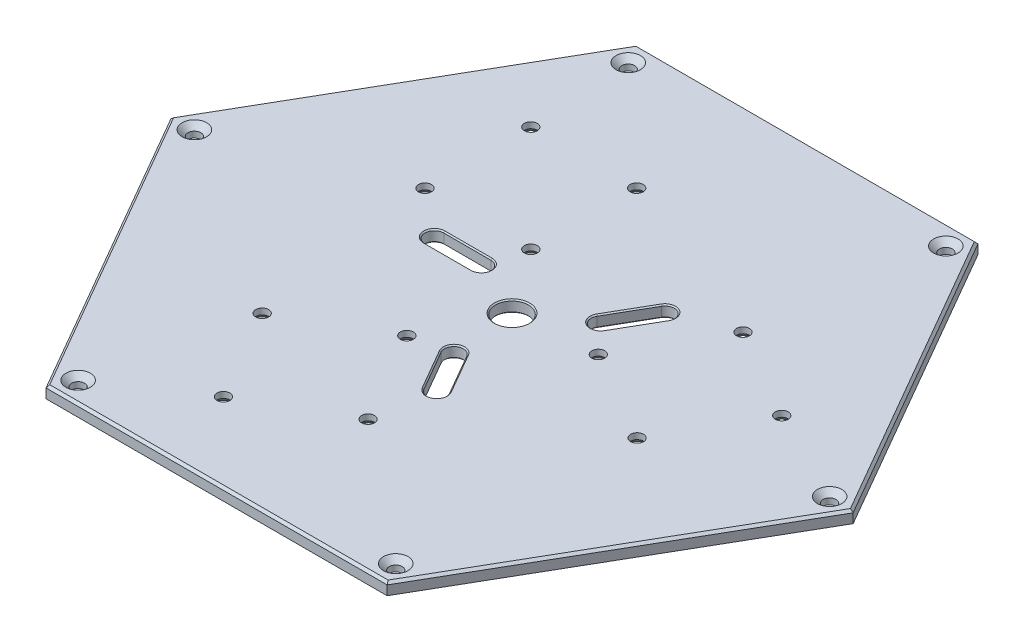
from build123d import *

# Parameters (mm, degrees)
BOSS_EXTRUDE1_DEPTH                             = 5
SKETCH5_R                                       = 7
CUT_EXTRUDE1_DEPTH                              = 192.882125275
CSK_FOR_M5_FLAT_HEAD_MACHINE_SCREW1_AT_2_COUNT  = 2
CSK_FOR_M5_FLAT_HEAD_MACHINE_SCREW1_AT_2_PITCH  = 45
CSK_FOR_M5_FLAT_HEAD_MACHINE_SCREW1_AT_3_COUNT  = 2
CSK_FOR_M5_FLAT_HEAD_MACHINE_SCREW1_AT_3_PITCH  = 63.639610307
CSK_FOR_M5_FLAT_HEAD_MACHINE_SCREW1_AT_4_COUNT  = 2
CSK_FOR_M5_FLAT_HEAD_MACHINE_SCREW1_AT_4_PITCH  = 45
CSK_FOR_M5_FLAT_HEAD_MACHINE_SCREW1_AT_5_COUNT  = 2
CSK_FOR_M5_FLAT_HEAD_MACHINE_SCREW1_AT_5_PITCH  = 101.046587643
CSK_FOR_M5_FLAT_HEAD_MACHINE_SCREW1_AT_6_COUNT  = 2
CSK_FOR_M5_FLAT_HEAD_MACHINE_SCREW1_AT_6_PITCH  = 144.828140716
CSK_FOR_M5_FLAT_HEAD_MACHINE_SCREW1_AT_7_COUNT  = 2
CSK_FOR_M5_FLAT_HEAD_MACHINE_SCREW1_AT_7_PITCH  = 159.73189246
CSK_FOR_M5_FLAT_HEAD_MACHINE_SCREW1_AT_8_COUNT  = 2
CSK_FOR_M5_FLAT_HEAD_MACHINE_SCREW1_AT_8_PITCH  = 121.44751953
CSK_FOR_M5_FLAT_HEAD_MACHINE_SCREW1_AT_9_COUNT  = 2
CSK_FOR_M5_FLAT_HEAD_MACHINE_SCREW1_AT_9_PITCH  = 76.964843439
CSK_FOR_M5_FLAT_HEAD_MACHINE_SCREW1_AT_1_COUNT  = 2
CSK_FOR_M5_FLAT_HEAD_MACHINE_SCREW1_AT_1_PITCH  = 121.44751953
CSK_FOR_M5_FLAT_HEAD_MACHINE_SCREW1_2_COUNT     = 2
CSK_FOR_M5_FLAT_HEAD_MACHINE_SCREW1_2_PITCH     = 124.337132551
CSK_FOR_M5_FLAT_HEAD_MACHINE_SCREW1_3_COUNT     = 2
CSK_FOR_M5_FLAT_HEAD_MACHINE_SCREW1_3_PITCH     = 81.448202292
CUT_EXTRUDE3_DEPTH                              = 192.882125275
CSK_FOR_M5_FLAT_HEAD_MACHINE_SCREW2_D           = 5.5
CSK_FOR_M5_FLAT_HEAD_MACHINE_SCREW2_DEPTH       = 10
CSK_FOR_M5_FLAT_HEAD_MACHINE_SCREW2_CSINK_D     = 10.4
CSK_FOR_M5_FLAT_HEAD_MACHINE_SCREW2_CSINK_ANGLE = 90
CSK_FOR_M5_FLAT_HEAD_MACHINE_SCREW2_TIP         = 1.652366702
CHAMFER1_SIZE                                   = 0.5
CHAMFER3_SIZE                                   = 0.5
CHAMFER4_SIZE                                   = 1


with BuildPart() as part:
    # Sketch1 → Boss-Extrude1 (new body)
    with BuildSketch(Plane(origin=(0, 0, 0), x_dir=(1, 0, 0), z_dir=(0, 1, 0))):
        Polygon((72.5, 125.573683549), (-72.5, 125.573683549), (-145, 0), (-72.5, -125.573683549), (72.5, -125.573683549), (145, 0), align=None)
    extrude(amount=BOSS_EXTRUDE1_DEPTH)

    # Sketch5 → Cut-Extrude1 (cut, through all)
    with BuildSketch(Plane(origin=(0, 5, 0), x_dir=(1, 0, 0), z_dir=(0, 1, 0))):
        Circle(SKETCH5_R)
    extrude(amount=-CUT_EXTRUDE1_DEPTH, mode=Mode.SUBTRACT)

    # Sketch6 → CSK for M5 Flat Head Machine Screw1 (revolve, cut)
    with BuildSketch(Plane(origin=(-64.5, 0, -27.5), x_dir=(0, 0, -1), z_dir=(1, 0, 0))):
        Polygon((0, 0), (0, 5), (2.75, 5), (2.75, 2.45), (5.2, 0), align=None)
    csk_for_m5_flat_head_machine_screw1 = revolve(axis=Axis((-64.5, -6.35, -27.5), (0, 1, 0)), mode=Mode.SUBTRACT)

    # CSK for M5 Flat Head Machine Screw1 at 2: CSK for M5 Flat Head Machine Screw1 ×2
    with Locations(*[(i * CSK_FOR_M5_FLAT_HEAD_MACHINE_SCREW1_AT_2_PITCH, 0, 0) for i in range(1, CSK_FOR_M5_FLAT_HEAD_MACHINE_SCREW1_AT_2_COUNT)]):
        add(csk_for_m5_flat_head_machine_screw1, mode=Mode.SUBTRACT)

    # CSK for M5 Flat Head Machine Screw1 at 3: CSK for M5 Flat Head Machine Screw1 ×2
    with Locations(*[Vector(0.7071067811865467, 0, -0.7071067811865485) * (i * CSK_FOR_M5_FLAT_HEAD_MACHINE_SCREW1_AT_3_PITCH) for i in range(1, CSK_FOR_M5_FLAT_HEAD_MACHINE_SCREW1_AT_3_COUNT)]):
        add(csk_for_m5_flat_head_machine_screw1, mode=Mode.SUBTRACT)

    # CSK for M5 Flat Head Machine Screw1 at 4: CSK for M5 Flat Head Machine Screw1 ×2
    with Locations(*[(0, 0, -i * CSK_FOR_M5_FLAT_HEAD_MACHINE_SCREW1_AT_4_PITCH) for i in range(1, CSK_FOR_M5_FLAT_HEAD_MACHINE_SCREW1_AT_4_COUNT)]):
        add(csk_for_m5_flat_head_machine_screw1, mode=Mode.SUBTRACT)

    # CSK for M5 Flat Head Machine Screw1 at 5: CSK for M5 Flat Head Machine Screw1 ×2
    with Locations(*[Vector(0.9704998544848913, 0, 0.2411017056032681) * (i * CSK_FOR_M5_FLAT_HEAD_MACHINE_SCREW1_AT_5_PITCH) for i in range(1, CSK_FOR_M5_FLAT_HEAD_MACHINE_SCREW1_AT_5_COUNT)]):
        add(csk_for_m5_flat_head_machine_screw1, mode=Mode.SUBTRACT)

    # CSK for M5 Flat Head Machine Screw1 at 6: CSK for M5 Flat Head Machine Screw1 ×2
    with Locations(*[Vector(0.9462031418522925, 0, 0.32357319782214755) * (i * CSK_FOR_M5_FLAT_HEAD_MACHINE_SCREW1_AT_6_PITCH) for i in range(1, CSK_FOR_M5_FLAT_HEAD_MACHINE_SCREW1_AT_6_COUNT)]):
        add(csk_for_m5_flat_head_machine_screw1, mode=Mode.SUBTRACT)

    # CSK for M5 Flat Head Machine Screw1 at 7: CSK for M5 Flat Head Machine Screw1 ×2
    with Locations(*[Vector(0.9987788870275944, 0, 0.04940379365918945) * (i * CSK_FOR_M5_FLAT_HEAD_MACHINE_SCREW1_AT_7_PITCH) for i in range(1, CSK_FOR_M5_FLAT_HEAD_MACHINE_SCREW1_AT_7_COUNT)]):
        add(csk_for_m5_flat_head_machine_screw1, mode=Mode.SUBTRACT)

    # CSK for M5 Flat Head Machine Screw1 at 8: CSK for M5 Flat Head Machine Screw1 ×2
    with Locations(*[Vector(0.9927390783329083, 0, -0.12028766499823594) * (i * CSK_FOR_M5_FLAT_HEAD_MACHINE_SCREW1_AT_8_PITCH) for i in range(1, CSK_FOR_M5_FLAT_HEAD_MACHINE_SCREW1_AT_8_COUNT)]):
        add(csk_for_m5_flat_head_machine_screw1, mode=Mode.SUBTRACT)

    # CSK for M5 Flat Head Machine Screw1 at 9: CSK for M5 Flat Head Machine Screw1 ×2
    with Locations(*[Vector(0.6552901187373239, 0, 0.7553772966440175) * (i * CSK_FOR_M5_FLAT_HEAD_MACHINE_SCREW1_AT_9_PITCH) for i in range(1, CSK_FOR_M5_FLAT_HEAD_MACHINE_SCREW1_AT_9_COUNT)]):
        add(csk_for_m5_flat_head_machine_screw1, mode=Mode.SUBTRACT)

    # CSK for M5 Flat Head Machine Screw1 at 1: CSK for M5 Flat Head Machine Screw1 ×2
    with Locations(*[Vector(0.6005417128168388, 0, 0.7995934286667303) * (i * CSK_FOR_M5_FLAT_HEAD_MACHINE_SCREW1_AT_1_PITCH) for i in range(1, CSK_FOR_M5_FLAT_HEAD_MACHINE_SCREW1_AT_1_COUNT)]):
        add(csk_for_m5_flat_head_machine_screw1, mode=Mode.SUBTRACT)

    # CSK for M5 Flat Head Machine Screw1  2: CSK for M5 Flat Head Machine Screw1 ×2
    with Locations(*[Vector(0.2731537838197167, 0, 0.9619703791619426) * (i * CSK_FOR_M5_FLAT_HEAD_MACHINE_SCREW1_2_PITCH) for i in range(1, CSK_FOR_M5_FLAT_HEAD_MACHINE_SCREW1_2_COUNT)]):
        add(csk_for_m5_flat_head_machine_screw1, mode=Mode.SUBTRACT)

    # CSK for M5 Flat Head Machine Screw1  3: CSK for M5 Flat Head Machine Screw1 ×2
    with Locations(*[Vector(0.14074169721357913, 0, 0.9900463497561319) * (i * CSK_FOR_M5_FLAT_HEAD_MACHINE_SCREW1_3_PITCH) for i in range(1, CSK_FOR_M5_FLAT_HEAD_MACHINE_SCREW1_3_COUNT)]):
        add(csk_for_m5_flat_head_machine_screw1, mode=Mode.SUBTRACT)

    # Sketch9 → Cut-Extrude3 (cut, through all)
    with BuildSketch(Plane.XZ):
        with BuildLine():
            Line((28.745190528, -34.788130468), (18.745190528, -17.467622393))
            ThreePointArc((18.745190528, -17.467622393), (20.209292144, -12.003520778), (25.673393759, -13.467622393))
            Line((25.673393759, -13.467622393), (35.673393759, -30.788130468))
            ThreePointArc((35.673393759, -30.788130468), (34.209292144, -36.252232084), (28.745190528, -34.788130468))
        make_face()
        with BuildLine():
            Line((-44.5, -7.5), (-24.5, -7.5))
            ThreePointArc((-24.5, -7.5), (-20.5, -11.5), (-24.5, -15.5))
            Line((-24.5, -15.5), (-44.5, -15.5))
            ThreePointArc((-44.5, -15.5), (-48.5, -11.5), (-44.5, -7.5))
        make_face()
        with BuildLine():
            Line((15.754809472, 42.288130468), (5.754809472, 24.967622393))
            ThreePointArc((5.754809472, 24.967622393), (0.290707856, 23.503520778), (-1.173393759, 28.967622393))
            Line((-1.173393759, 28.967622393), (8.826606241, 46.288130468))
            ThreePointArc((8.826606241, 46.288130468), (14.290707856, 47.752232084), (15.754809472, 42.288130468))
        make_face()
    extrude(amount=-CUT_EXTRUDE3_DEPTH, mode=Mode.SUBTRACT)

    # CSK for M5 Flat Head Machine Screw2
    with Locations(Plane(origin=(0, 5, 0), x_dir=(1, 0, 0), z_dir=(0, 1, 0))):
        with Locations((-135, 0), (-67.5, -116.913429511), (67.5, -116.913429511), (135, 0), (67.5, 116.913429511), (-67.5, 116.913429511)):
            CounterSinkHole(CSK_FOR_M5_FLAT_HEAD_MACHINE_SCREW2_D / 2, CSK_FOR_M5_FLAT_HEAD_MACHINE_SCREW2_CSINK_D / 2, depth=CSK_FOR_M5_FLAT_HEAD_MACHINE_SCREW2_DEPTH, counter_sink_angle=CSK_FOR_M5_FLAT_HEAD_MACHINE_SCREW2_CSINK_ANGLE)
            with Locations((0, 0, -(CSK_FOR_M5_FLAT_HEAD_MACHINE_SCREW2_DEPTH + CSK_FOR_M5_FLAT_HEAD_MACHINE_SCREW2_TIP / 2))):  # 118° drill point
                Cone(0, CSK_FOR_M5_FLAT_HEAD_MACHINE_SCREW2_D / 2, CSK_FOR_M5_FLAT_HEAD_MACHINE_SCREW2_TIP, mode=Mode.SUBTRACT)

    # Chamfer1
    chamfer1_edges = [part.edges().sort_by_distance(p)[0] for p in [
        (-34.5, 0, -15.5),
        (-20.5, 0, -11.5),
        (-48.5, 0, -11.5),
        (-34.5, 0, -7.5),
        (23.745190528, 0, -26.127876431),
        (34.209292144, 0, -36.252232084),
        (20.209292144, 0, -12.003520778),
        (30.673393759, 0, -22.127876431),
        (3.826606241, 0, 37.627876431),
        (0.290707856, 0, 23.503520778),
        (14.290707856, 0, 47.752232084),
        (10.754809472, 0, 33.627876431),
        (-34.5, 5, -15.5),
        (-20.5, 5, -11.5),
        (-48.5, 5, -11.5),
        (-34.5, 5, -7.5),
        (23.745190528, 5, -26.127876431),
        (34.209292144, 5, -36.252232084),
        (20.209292144, 5, -12.003520778),
        (30.673393759, 5, -22.127876431),
        (3.826606241, 5, 37.627876431),
        (0.290707856, 5, 23.503520778),
        (14.290707856, 5, 47.752232084),
        (10.754809472, 5, 33.627876431),
    ]]
    chamfer(chamfer1_edges, length=CHAMFER1_SIZE)

    # Chamfer3
    chamfer3_edges = [part.edges().sort_by_distance(p)[0] for p in [
        (-7, 5, 0),
        (-7, 0, 0),
    ]]
    chamfer(chamfer3_edges, length=CHAMFER3_SIZE)

    # Chamfer4
    chamfer4_edges = [part.edges().sort_by_distance(p)[0] for p in [
        (0, 5, 125.573683549),
        (108.75, 5, 62.786841774),
        (108.75, 5, -62.786841774),
        (0, 5, -125.573683549),
        (-108.75, 5, -62.786841774),
        (-108.75, 5, 62.786841774),
    ]]
    chamfer(chamfer4_edges, length=CHAMFER4_SIZE)


solid = part.part
